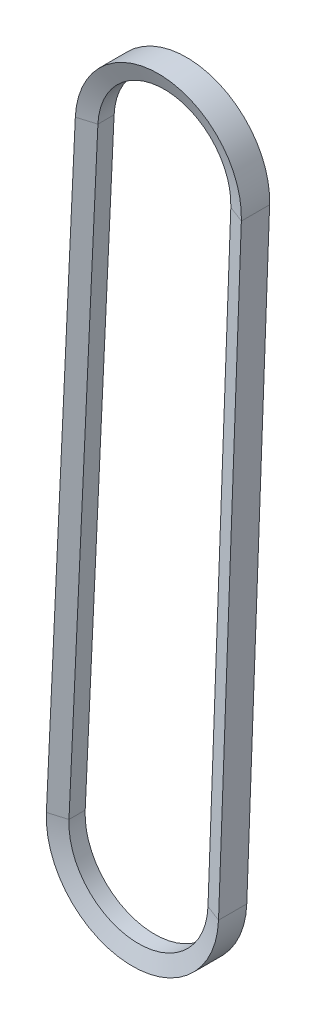
from build123d import *


with BuildPart() as part:
    # Sweep1: sweep along a path in Sketch2
    with BuildLine(Plane.XY) as sweep1_path:
        Line((27.980824863, -1.036069477), (20.284402308, -208.891098823))
        ThreePointArc((20.284402308, -208.891098823), (-9.938346888, -236.817153763), (-37.715040948, -206.457075032))
        Line((-37.715040948, -206.457075032), (-27.969247182, 1.311949725))
        ThreePointArc((-27.969247182, 1.311949725), (1.174023873, 27.9753761), (27.980824863, -1.036069477))
    # Sketch3 → Sweep1 (sweep)
    with BuildSketch(Plane(origin=(27.980824863, -1.036069477, 0), x_dir=(-0.9993151736941521, 0.037002481330673936, 0), z_dir=(-0.037002481330673936, -0.9993151736941521, 0))):
        Polygon((0, 4.7625), (0, -4.7625), (5.588, -2.728634331), (5.588, 2.728634331), align=None)
    sweep(path=sweep1_path.line)


solid = part.part
